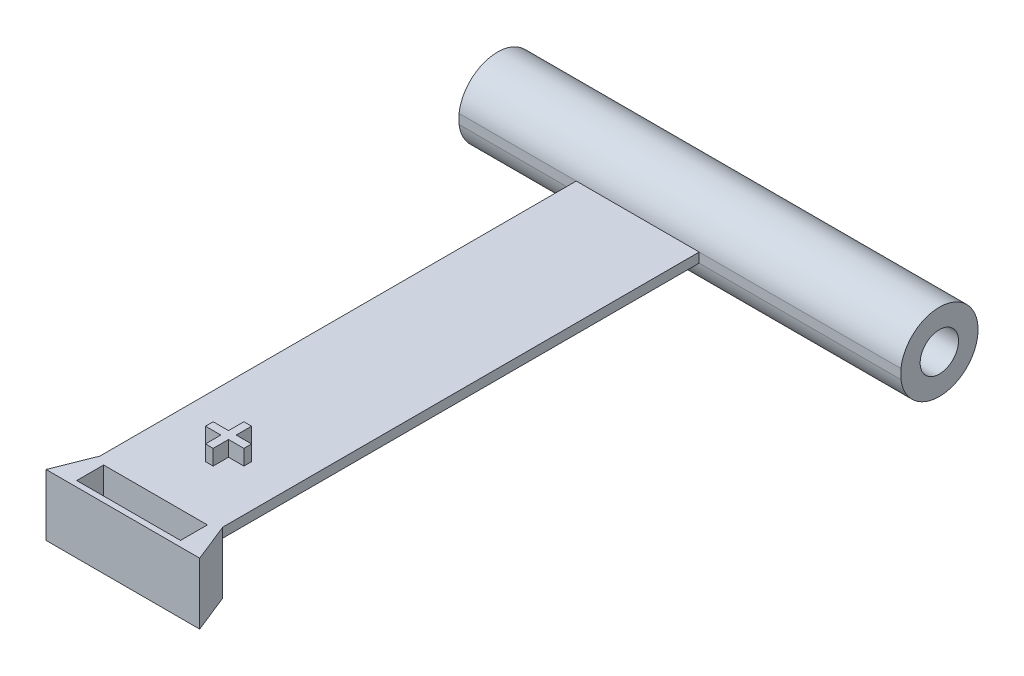
from build123d import *

# Parameters (mm, degrees)
BOSS_EXTRUDE2_DEPTH      = 32
SKETCH5_W                = 54
SKETCH5_H                = 14
CUT_EXTRUDE1_DEPTH       = 32
SKETCH6_W                = 64
SKETCH6_H                = 5
BOSS_EXTRUDE3_DEPTH      = 70
BOSS_EXTRUDE4_DEPTH      = 8
SKETCH8_W                = 64
SKETCH8_H                = 5
BOSS_EXTRUDE5_DEPTH      = 178
BOSS_EXTRUDE7_DEPTH      = 105
BOSS_EXTRUDE7_DEPTH_BACK = 125
SKETCH14_R               = 10
CUT_EXTRUDE4_DEPTH       = 264


with BuildPart() as part:
    # Sketch4 → Boss-Extrude2 (new body)
    with BuildSketch(Plane(origin=(0, 0, 0), x_dir=(1, 0, 0), z_dir=(0, 1, 0))):
        Polygon((8, 20), (0, 0), (80, 0), (72, 20), align=None)
    extrude(amount=BOSS_EXTRUDE2_DEPTH)

    # Sketch5 → Cut-Extrude1 (cut)
    with BuildSketch(Plane(origin=(0, 32, 0), x_dir=(1, 0, 0), z_dir=(0, 1, 0))):
        with Locations((40, 10)):
            Rectangle(SKETCH5_W, SKETCH5_H)
    extrude(amount=-CUT_EXTRUDE1_DEPTH, mode=Mode.SUBTRACT)

    # Sketch6 → Boss-Extrude3 (add)
    with BuildSketch(Plane(origin=(0, 0, -20), x_dir=(-1, 0, 0), z_dir=(0, 0, -1))):
        with Locations((-40, 29.5)):
            Rectangle(SKETCH6_W, SKETCH6_H)
    extrude(amount=BOSS_EXTRUDE3_DEPTH)

    # Sketch7 → Boss-Extrude4 (add)
    with BuildSketch(Plane(origin=(0, 32, 0), x_dir=(1, 0, 0), z_dir=(0, 1, 0))):
        Polygon((30, 57), (30, 53), (38, 53), (38, 45), (42, 45), (42, 53), (50, 53), (50, 57), (42, 57), (42, 65), (38, 65), (38, 57), align=None)
    extrude(amount=BOSS_EXTRUDE4_DEPTH)

    # Sketch8 → Boss-Extrude5 (add)
    with BuildSketch(Plane(origin=(0, 0, -90), x_dir=(-1, 0, 0), z_dir=(0, 0, -1))):
        with Locations((-40, 29.5)):
            Rectangle(SKETCH8_W, SKETCH8_H)
    extrude(amount=BOSS_EXTRUDE5_DEPTH)

    # Sketch13 → Boss-Extrude7 (add, two sides: drawn at the far end of the back side and taken through both)
    with BuildSketch(Plane(origin=(72, 0, 0), x_dir=(0, 0, -1), z_dir=(1, 0, 0)).offset(-BOSS_EXTRUDE7_DEPTH_BACK)):
        with BuildLine():
            ThreePointArc((268, 27), (289.252420174, 9.383304354), (308.155644371, 29.5))
            ThreePointArc((308.155644371, 29.5), (289.252420174, 49.616695646), (268, 32))
            Line((268, 32), (268, 29.5))
            Line((268, 29.5), (268, 27))
        make_face()
    extrude(amount=BOSS_EXTRUDE7_DEPTH + BOSS_EXTRUDE7_DEPTH_BACK)

    # Sketch14 → Cut-Extrude4 (cut)
    with BuildSketch(Plane(origin=(177, 0, 0), x_dir=(0, 0, -1), z_dir=(1, 0, 0))):
        with Locations((288, 29.5)):
            Circle(SKETCH14_R)
    extrude(amount=-CUT_EXTRUDE4_DEPTH, mode=Mode.SUBTRACT)


solid = part.part
